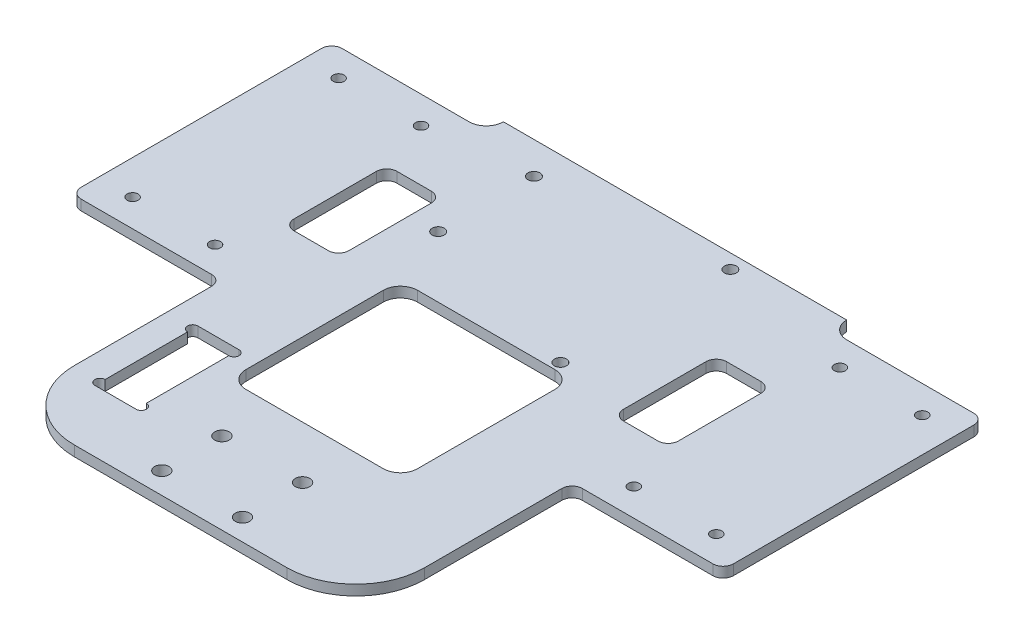
from build123d import *

# Parameters (mm, degrees)
SKETCH_1_R          = 2.1
SKETCH_1_R_2        = 1.6
EXTRUDE_1_DEPTH     = 3
SKETCH_4_W          = 100
SKETCH_4_H          = 3
EXTRUDE_2_DEPTH     = 5
FILLET_1_R          = 5
HOLE_WIZARD_1_D     = 3.5
HOLE_WIZARD_1_DEPTH = 100
SKETCH_5_W          = 12
SKETCH_5_H          = 30
CUT_EXTRUDE_1_DEPTH = 10
HOLE_WIZARD_2_D     = 3


with BuildPart() as part:
    # 草图1 → 凸台-拉伸1 (new body)
    with BuildSketch(Plane(origin=(0, 0, 0), x_dir=(1, 0, 0), z_dir=(0, 1, 0))):
        with BuildLine():
            Line((-31, 0), (31, 0))
            ThreePointArc((31, 0), (45.142135624, 5.857864376), (51, 20))
            Line((51, 20), (51, 60))
            ThreePointArc((51, 60), (51.878679656, 62.121320344), (54, 63))
            Line((54, 63), (92, 63))
            ThreePointArc((92, 63), (94.121320344, 63.878679656), (95, 66))
            Line((95, 66), (95, 136))
            ThreePointArc((95, 136), (94.121320344, 138.121320344), (92, 139))
            Line((92, 139), (-92, 139))
            ThreePointArc((-92, 139), (-94.121320344, 138.121320344), (-95, 136))
            Line((-95, 136), (-95, 66))
            ThreePointArc((-95, 66), (-94.121320344, 63.878679656), (-92, 63))
            Line((-92, 63), (-54, 63))
            ThreePointArc((-54, 63), (-51.878679656, 62.121320344), (-51, 60))
            Line((-51, 60), (-51, 20))
            ThreePointArc((-51, 20), (-45.142135624, 5.857864376), (-31, 0))
        make_face()
        with Locations(Location((-11.75, 23.75, 0), (0, 0, 270))):
            Circle(SKETCH_1_R, mode=Mode.SUBTRACT)
        with Locations(Location((11.75, 23.75, 0), (0, 0, 270))):
            Circle(SKETCH_1_R, mode=Mode.SUBTRACT)
        with Locations(Location((11.75, 6.25, 0), (0, 0, 270))):
            Circle(SKETCH_1_R, mode=Mode.SUBTRACT)
        with Locations(Location((-11.75, 6.25, 0), (0, 0, 270))):
            Circle(SKETCH_1_R, mode=Mode.SUBTRACT)
        with Locations(Location((-61, 71, 0), (0, 0, 270))):
            Circle(SKETCH_1_R_2, mode=Mode.SUBTRACT)
        with Locations(Location((-61, 131, 0), (0, 0, 270))):
            Circle(SKETCH_1_R_2, mode=Mode.SUBTRACT)
        with Locations(Location((-85, 131, 0), (0, 0, 270))):
            Circle(SKETCH_1_R_2, mode=Mode.SUBTRACT)
        with Locations(Location((-85, 71, 0), (0, 0, 270))):
            Circle(SKETCH_1_R_2, mode=Mode.SUBTRACT)
        with Locations(Location((85, 71, 0), (0, 0, 90))):
            Circle(SKETCH_1_R_2, mode=Mode.SUBTRACT)
        with Locations(Location((85, 131, 0), (0, 0, 90))):
            Circle(SKETCH_1_R_2, mode=Mode.SUBTRACT)
        with Locations(Location((61, 131, 0), (0, 0, 90))):
            Circle(SKETCH_1_R_2, mode=Mode.SUBTRACT)
        with Locations(Location((61, 71, 0), (0, 0, 90))):
            Circle(SKETCH_1_R_2, mode=Mode.SUBTRACT)
        with BuildLine():
            Line((-53, 116), (-43, 116))
            ThreePointArc((-43, 116), (-40.878679656, 115.121320344), (-40, 113))
            Line((-40, 113), (-40, 89))
            ThreePointArc((-40, 89), (-40.878679656, 86.878679656), (-43, 86))
            Line((-43, 86), (-53, 86))
            ThreePointArc((-53, 86), (-55.121320344, 86.878679656), (-56, 89))
            Line((-56, 89), (-56, 113))
            ThreePointArc((-56, 113), (-55.121320344, 115.121320344), (-53, 116))
        make_face(mode=Mode.SUBTRACT)
        with BuildLine():
            Line((40, 113), (40, 89))
            ThreePointArc((40, 89), (40.878679656, 86.878679656), (43, 86))
            Line((43, 86), (53, 86))
            ThreePointArc((53, 86), (55.121320344, 86.878679656), (56, 89))
            Line((56, 89), (56, 113))
            ThreePointArc((56, 113), (55.121320344, 115.121320344), (53, 116))
            Line((53, 116), (43, 116))
            ThreePointArc((43, 116), (40.878679656, 115.121320344), (40, 113))
        make_face(mode=Mode.SUBTRACT)
        with BuildLine():
            Line((-20, 89), (20, 89))
            ThreePointArc((20, 89), (23.535533906, 87.535533906), (25, 84))
            Line((25, 84), (25, 44))
            ThreePointArc((25, 44), (23.535533906, 40.464466094), (20, 39))
            Line((20, 39), (-20, 39))
            ThreePointArc((-20, 39), (-23.535533906, 40.464466094), (-25, 44))
            Line((-25, 44), (-25, 84))
            ThreePointArc((-25, 84), (-23.535533906, 87.535533906), (-20, 89))
        make_face(mode=Mode.SUBTRACT)
    extrude(amount=EXTRUDE_1_DEPTH)

    # 草图4 → 凸台-拉伸2 (add)
    with BuildSketch(Plane(origin=(0, 0, -139), x_dir=(-1, 0, 0), z_dir=(0, 0, -1))):
        with Locations((0, 1.5)):
            Rectangle(SKETCH_4_W, SKETCH_4_H)
    extrude(amount=EXTRUDE_2_DEPTH)

    # 圆角1
    fillet_1_edges = [part.edges().sort_by_distance(p)[0] for p in [
        (50, 1.5, -139),
        (-50, 1.5, -139),
    ]]
    fillet(fillet_1_edges, radius=FILLET_1_R - 0.0001)  # a hair under: the kernel refuses the full size

    # 孔1
    with Locations(Plane(origin=(0, 3, 0), x_dir=(1, 0, 0), z_dir=(0, 1, 0))):
        with Locations((-31.8, 134.7), (-31.8, 106.8), (19, 91.6), (20.3, 139.8)):
            Hole(HOLE_WIZARD_1_D / 2, depth=HOLE_WIZARD_1_DEPTH)

    # 草图5 → 切除-拉伸1 (cut)
    with BuildSketch(Plane(origin=(0, 3, 0), x_dir=(1, 0, 0), z_dir=(0, 1, 0))):
        with Locations((-37, 33)):
            Rectangle(SKETCH_5_W, SKETCH_5_H)
    extrude(amount=-CUT_EXTRUDE_1_DEPTH, mode=Mode.SUBTRACT)

    # 孔2 (through all)
    with Locations(Plane(origin=(0, 3, 0), x_dir=(1, 0, 0), z_dir=(0, 1, 0))):
        with Locations((-43, 46.5), (-31, 46.5), (-31, 19.5), (-43, 19.5)):
            Hole(HOLE_WIZARD_2_D / 2)


solid = part.part
